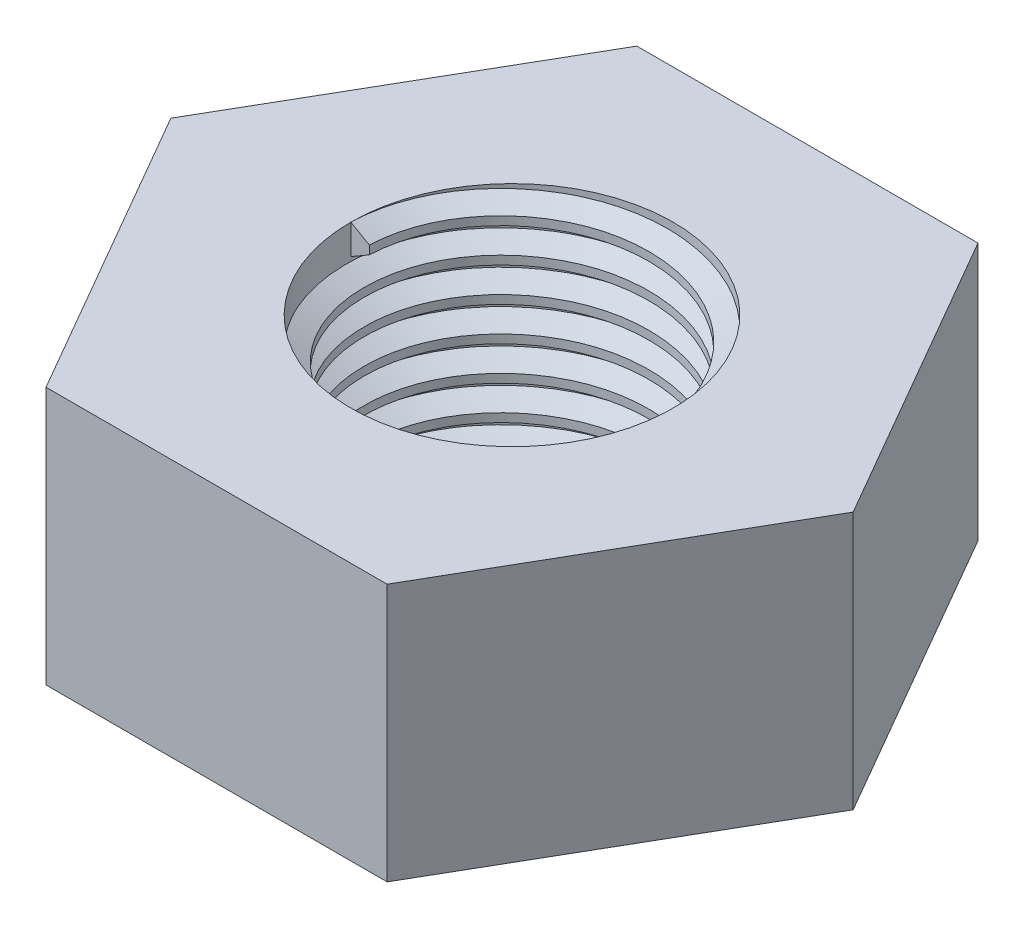
from build123d import *
from build123d.topology import SkipClean

# Parameters (mm, degrees)
AUFSATZ_LINEAR_AUSTRAGEN1_DEPTH = 2.4
SKIZZE3_R                       = 1.5
SCHNITT_LINEAR_AUSTRAGEN1_DEPTH = 2.4
GEWINDE1_PITCH                  = 0.3175


with BuildPart() as part:
    # Skizze2 → Aufsatz-Linear austragen1 (new body)
    with BuildSketch(Plane(origin=(0, 0, 0), x_dir=(1, 0, 0), z_dir=(0, 1, 0))):
        Polygon((3.175426481, 0), (1.58771324, 2.75), (-1.58771324, 2.75), (-3.175426481, 0), (-1.58771324, -2.75), (1.58771324, -2.75), align=None)
    extrude(amount=AUFSATZ_LINEAR_AUSTRAGEN1_DEPTH)

    # Skizze3 → Schnitt-Linear austragen1 (cut)
    with BuildSketch(Plane(origin=(0, 2.4, 0), x_dir=(1, 0, 0), z_dir=(0, 1, 0))):
        with Locations(Location((0, 0, 0), (0, 0, 270))):
            Circle(SKIZZE3_R)
    extrude(amount=-SCHNITT_LINEAR_AUSTRAGEN1_DEPTH, mode=Mode.SUBTRACT)

    # Gewinde1: the profile of Gewindeprofil1 profile screwed along a right-hand helix of 7 turns, 6 arcs to a turn; built about Z, then put on its axis
    with SkipClean():  # the faces are left unmerged after this step: merging them gives an invalid solid
        gewinde1_z = Axis((0, 0, 0), (0, 0, 1))
        gewinde1_corners = [(1.5003, 0, -0.000173205), (1.5003, 0, 0.277985704), (1.328148085, 0, 0.17859375), (1.328148085, 0, 0.09921875)]
        with BuildLine(mode=Mode.PRIVATE) as gewinde1_profile:
            Line(gewinde1_corners[0], gewinde1_corners[1])
            Line(gewinde1_corners[1], gewinde1_corners[2])
            Line(gewinde1_corners[2], gewinde1_corners[3])
            Line(gewinde1_corners[3], gewinde1_corners[0])
        gewinde1_cap = Face(gewinde1_profile.wire())
        gewinde1_turn_angles = [0, 30, 60, 90, 120, 150, 180, 210, 240, 270, 300, 330, 360]
        gewinde1_turn_weights = [1, 0.8660254037844387, 1, 0.8660254037844387, 1, 0.8660254037844387, 1, 0.8660254037844387, 1, 0.8660254037844387, 1, 0.8660254037844387, 1]
        gewinde1_turn_rails = [Edge.make_bspline([Vector(p[0], p[1], 0).rotate(gewinde1_z, gewinde1_turn_angles[k]) / gewinde1_turn_weights[k] + Vector(0, 0, p[2] + GEWINDE1_PITCH * gewinde1_turn_angles[k] / 360) for k in range(13)], [0, 0, 0, 1, 1, 2, 2, 3, 3, 4, 4, 5, 5, 6, 6, 6], 2, gewinde1_turn_weights) for p in gewinde1_corners]
        gewinde1_turn_sides = [Face.make_surface_from_curves(gewinde1_turn_rails[p[0]], gewinde1_turn_rails[p[1]]) for p in [(0, 1), (1, 2), (2, 3), (3, 0)]]
        gewinde1 = Plane(origin=(0, 2.4, 0), x_dir=(-1, 0, 0), z_dir=(0, -1, 0)) * Solid(Shell([*[p.moved(Location((0, 0, GEWINDE1_PITCH * i))) for i in range(7) for p in gewinde1_turn_sides], gewinde1_cap, gewinde1_cap.rotate(gewinde1_z, 2520).moved(Location((0, 0, GEWINDE1_PITCH * 2520 / 360)))]))
        add(gewinde1)


solid = part.part
